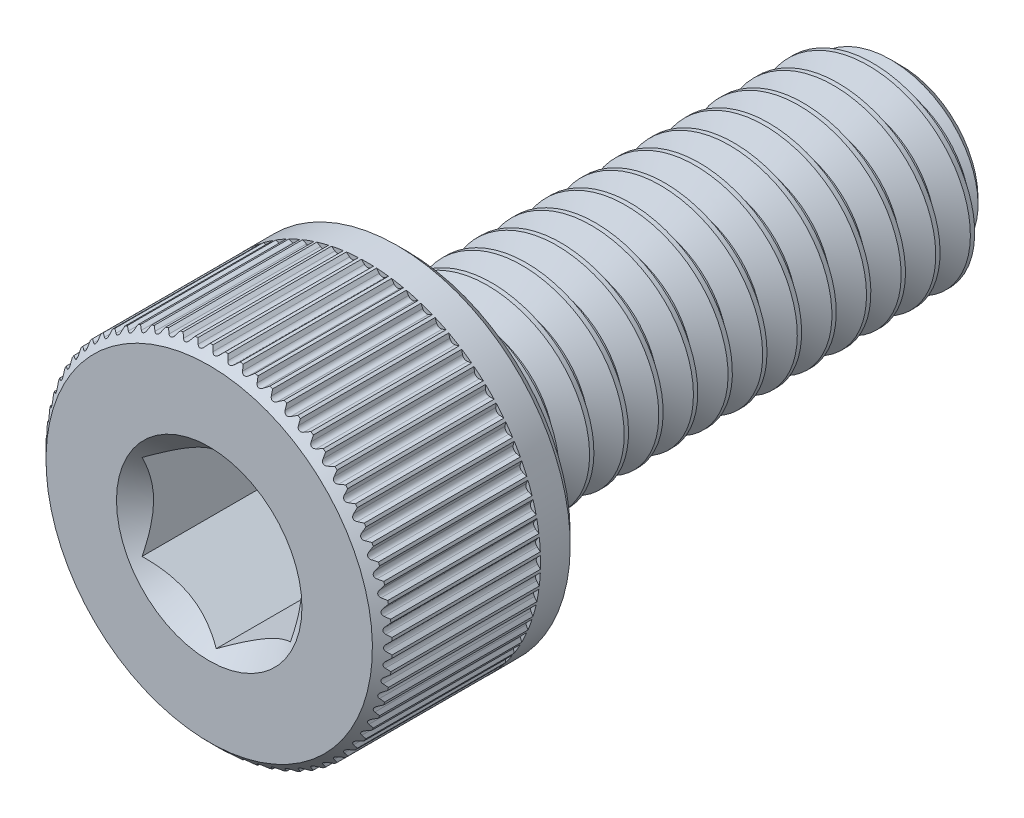
from build123d import *

# Parameters (mm, degrees)
CUT_EXTRUDE1_DEPTH     = 3
SPLIT1_SURFACE_1_BACK  = 18.146
SPLIT1_SURFACE_1_DEPTH = 36.292
SPLIT1_SURFACE_2_BACK  = 18.146
SPLIT1_SURFACE_2_DEPTH = 36.292
CUT_SWEEP1_PITCH       = 0.7
CUT_EXTRUDE3_DEPTH     = 3.2
CIRPATTERN1_COUNT      = 72


with BuildPart() as part:
    # Sketch2 → Revolve1 (revolve)
    with BuildSketch(Plane(origin=(0, 0, 0), x_dir=(0, 0, -1), z_dir=(1, 0, 0))):
        with BuildLine():
            Line((-7, 0), (-7, 3.3))
            Line((-7, 3.3), (-6.8, 3.5))
            Line((-6.8, 3.5), (-3.2, 3.5))
            Line((-3.2, 3.5), (-3, 3.3))
            Line((-3, 3.3), (-3, 2.2))
            ThreePointArc((-3, 2.2), (-2.941421356, 2.058578644), (-2.8, 2))
            Line((-2.8, 2), (6.545336663, 2))
            Line((6.545336663, 2), (7, 1.545336663))
            Line((7, 1.545336663), (7, 0))
            Line((7, 0), (-7, 0))
        make_face()
    revolve(axis=Axis((0, 0, -7), (0, 0, 1)))

    # Sketch3 → Cut-Extrude1 (cut)
    with BuildSketch(Plane.XY.offset(7)):
        Polygon((1.5, -0.866025404), (1.5, 0.866025404), (0, 1.732050808), (-1.5, 0.866025404), (-1.5, -0.866025404), (0, -1.732050808), align=None)
    extrude(amount=-CUT_EXTRUDE1_DEPTH, mode=Mode.SUBTRACT)

    # Cut-Extrude2 cone 1 section (through the dimple's axis) → Cut-Extrude2 (revolve, cut)
    with BuildSketch(Plane(origin=(0, 0, 7), x_dir=(0, -1, 0), z_dir=(1, 0, 0))):
        Polygon((0, 0), (1.875, 0), (0, 1.875), align=None)
    revolve(axis=Axis((0, 0, 7), (0, 0, -1)), mode=Mode.SUBTRACT)


with BuildPart() as body_2:
    # Split1: the piece behind the surface
    add(part.part)
    # Split1 surface: a surface, the sketch's curves swept straight by 36.292 mm
    with BuildLine(Plane(origin=(0, 0, 0), x_dir=(0, 0, -1), z_dir=(1, 0, 0)).offset(-SPLIT1_SURFACE_1_BACK), mode=Mode.PRIVATE) as split1_surface_1_path:
        Line((-2.8, -3.5), (-2.8, 3.5))
    split1_surface_1 = Shell.extrude(split1_surface_1_path.wire(), (1 * SPLIT1_SURFACE_1_DEPTH, 0 * SPLIT1_SURFACE_1_DEPTH, 0 * SPLIT1_SURFACE_1_DEPTH))
    split(bisect_by=split1_surface_1, keep=Keep.BOTTOM)

    # Cut-Sweep1: the profile of Sketch7 screwed along a right-hand helix of 15.285714 turns, 6 arcs to a turn; built about Z, then put on its axis
    cut_sweep1_z = Axis((0, 0, 0), (0, 0, 1))
    cut_sweep1_corners = [(2.037888611, 0, 0.021875), (2.037888611, 0, -0.634375), (1.545336663, 0, -0.35), (1.545336663, 0, -0.2625)]
    with BuildLine(mode=Mode.PRIVATE) as cut_sweep1_profile:
        Line(cut_sweep1_corners[0], cut_sweep1_corners[1])
        Line(cut_sweep1_corners[1], cut_sweep1_corners[2])
        Line(cut_sweep1_corners[2], cut_sweep1_corners[3])
        Line(cut_sweep1_corners[3], cut_sweep1_corners[0])
    cut_sweep1_cap = Face(cut_sweep1_profile.wire())
    cut_sweep1_turn_angles = [0, 30, 60, 90, 120, 150, 180, 210, 240, 270, 300, 330, 360]
    cut_sweep1_turn_weights = [1, 0.8660254037844387, 1, 0.8660254037844387, 1, 0.8660254037844387, 1, 0.8660254037844387, 1, 0.8660254037844387, 1, 0.8660254037844387, 1]
    cut_sweep1_turn_rails = [Edge.make_bspline([Vector(p[0], p[1], 0).rotate(cut_sweep1_z, cut_sweep1_turn_angles[k]) / cut_sweep1_turn_weights[k] + Vector(0, 0, p[2] + CUT_SWEEP1_PITCH * cut_sweep1_turn_angles[k] / 360) for k in range(13)], [0, 0, 0, 1, 1, 2, 2, 3, 3, 4, 4, 5, 5, 6, 6, 6], 2, cut_sweep1_turn_weights) for p in cut_sweep1_corners]
    cut_sweep1_turn_sides = [Face.make_surface_from_curves(cut_sweep1_turn_rails[p[0]], cut_sweep1_turn_rails[p[1]]) for p in [(0, 1), (1, 2), (2, 3), (3, 0)]]
    cut_sweep1_last_angles = [5400, 5430, 5460, 5481.428571429, 5502.857142857]
    cut_sweep1_last_weights = [1, 0.8660254037844387, 1, 0.9308737486442353, 1]
    cut_sweep1_last_rails = [Edge.make_bspline([Vector(p[0], p[1], 0).rotate(cut_sweep1_z, cut_sweep1_last_angles[k]) / cut_sweep1_last_weights[k] + Vector(0, 0, p[2] + CUT_SWEEP1_PITCH * cut_sweep1_last_angles[k] / 360) for k in range(5)], [0, 0, 0, 1, 1, 2, 2, 2], 2, cut_sweep1_last_weights) for p in cut_sweep1_corners]
    cut_sweep1_last_sides = [Face.make_surface_from_curves(cut_sweep1_last_rails[p[0]], cut_sweep1_last_rails[p[1]]) for p in [(0, 1), (1, 2), (2, 3), (3, 0)]]
    cut_sweep1 = Plane(origin=(0, 0, -7), x_dir=(0, 1, 0), z_dir=(0, 0, 1)) * Solid(Shell([*[p.moved(Location((0, 0, CUT_SWEEP1_PITCH * i))) for i in range(15) for p in cut_sweep1_turn_sides], *cut_sweep1_last_sides, cut_sweep1_cap, cut_sweep1_cap.rotate(cut_sweep1_z, 5502.857142857).moved(Location((0, 0, CUT_SWEEP1_PITCH * 5502.857142857 / 360)))]))
    add(cut_sweep1, mode=Mode.SUBTRACT)


with BuildPart() as part_1:
    add(part.part)

    # Split1: split by a surface, the side it looks to stays
    # Split1 surface: a surface, the sketch's curves swept straight by 36.292 mm
    with BuildLine(Plane(origin=(0, 0, 0), x_dir=(0, 0, -1), z_dir=(1, 0, 0)).offset(-SPLIT1_SURFACE_2_BACK), mode=Mode.PRIVATE) as split1_surface_2_path:
        Line((-2.8, -3.5), (-2.8, 3.5))
    split1_surface_2 = Shell.extrude(split1_surface_2_path.wire(), (1 * SPLIT1_SURFACE_2_DEPTH, 0 * SPLIT1_SURFACE_2_DEPTH, 0 * SPLIT1_SURFACE_2_DEPTH))
    split(bisect_by=split1_surface_2, keep=Keep.TOP)

    add(body_2.part)  # Revolve2 merges body 2
    # Sketch8 → Revolve2 (revolve)
    with BuildSketch(Plane(origin=(0, 0, 0), x_dir=(0, 0, -1), z_dir=(1, 0, 0)), mode=Mode.PRIVATE) as revolve2_sk:
        Polygon((-3, 0), (-3, 2), (-2.8, 2), (-1.645299462, 0), align=None)
    revolve(revolve2_sk.sketch.rotate(Axis((0, 0, 1.645299462), (0, 0, 1)), 270), axis=Axis((0, 0, 1.645299462), (0, 0, 1)))

    # Sketch12 → Cut-Extrude3 (cut)
    with BuildSketch(Plane.XY.offset(7)):
        with BuildLine():
            Line((-0.211780344, 3.5875), (0.211780344, 3.5875))
            Line((0.211780344, 3.5875), (0.062787974, 3.438507631))
            ThreePointArc((0.062787974, 3.438507631), (0, 3.4125), (-0.062787974, 3.438507631))
            Line((-0.062787974, 3.438507631), (-0.211780344, 3.5875))
        make_face()
    cut_extrude3 = extrude(amount=-CUT_EXTRUDE3_DEPTH, mode=Mode.SUBTRACT)

    # CirPattern1: Cut-Extrude3 ×72 about axis
    cirpattern1_axis = Axis((0, 0, 0), (0, 0, 1))
    for i in range(1, CIRPATTERN1_COUNT):
        add(cut_extrude3.rotate(cirpattern1_axis, i * 360 / CIRPATTERN1_COUNT), mode=Mode.SUBTRACT)


solid = part_1.part
